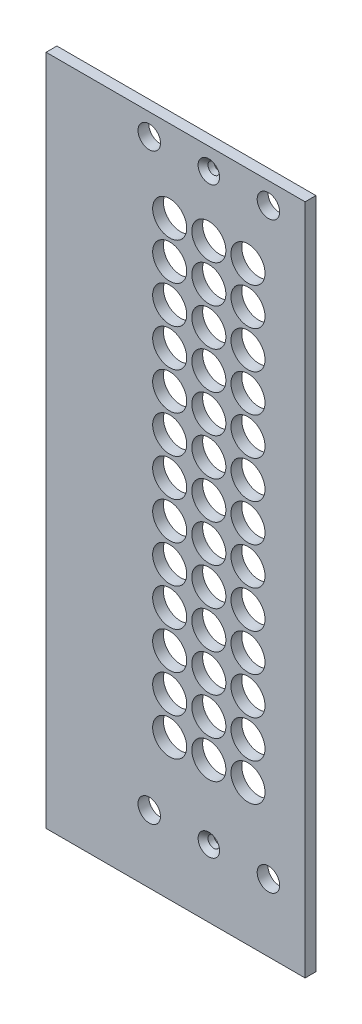
from build123d import *

# Parameters (mm, degrees)
SKETCH1_W                                       = 56.55
SKETCH1_H                                       = 197.425
BOSS_EXTRUDE1_DEPTH                             = 3.175
SKETCH4_R                                       = 5
CUT_EXTRUDE2_DEPTH                              = 103.731270343
LPATTERN3_COUNT                                 = 13
LPATTERN3_PITCH                                 = 11
SKETCH5_W                                       = 3.175
SKETCH5_H                                       = 197.425
BOSS_EXTRUDE2_DEPTH                             = 19.525
CSK_FOR_M3_FLAT_HEAD_MACHINE_SCREW1_D           = 3.4
CSK_FOR_M3_FLAT_HEAD_MACHINE_SCREW1_CSINK_D     = 6.3
CSK_FOR_M3_FLAT_HEAD_MACHINE_SCREW1_CSINK_ANGLE = 90
M6_CLEARANCE_HOLE1_D                            = 6.6


with BuildPart() as part:
    # Sketch1 → Boss-Extrude1 (new body)
    with BuildSketch(Plane.XY):
        Rectangle(SKETCH1_W, SKETCH1_H)
    extrude(amount=BOSS_EXTRUDE1_DEPTH)

    # Sketch4 → Cut-Extrude2 (cut, through all)
    with BuildSketch(Plane.XY.offset(3.175)):
        with Locations((0, -57.369162839)):
            Circle(SKETCH4_R)
        with Locations((11.5, -57.369162839)):
            Circle(SKETCH4_R)
        with Locations((-11.5, -57.369162839)):
            Circle(SKETCH4_R)
    cut_extrude2 = extrude(amount=-CUT_EXTRUDE2_DEPTH, mode=Mode.SUBTRACT)

    # LPattern3: Cut-Extrude2 ×13
    with Locations(*[(0, i * LPATTERN3_PITCH, 0) for i in range(1, LPATTERN3_COUNT)]):
        add(cut_extrude2, mode=Mode.SUBTRACT)

    # Sketch5 → Boss-Extrude2 (add)
    with BuildSketch(Plane.ZY.offset(28.275)):
        with Locations((1.5875, 0)):
            Rectangle(SKETCH5_W, SKETCH5_H)
    extrude(amount=BOSS_EXTRUDE2_DEPTH)

    # CSK for M3 Flat Head Machine Screw1 (through all)
    with Locations(Plane.XY.offset(3.175)):
        with Locations((0, 92.3625), (0, -78.8875)):
            CounterSinkHole(CSK_FOR_M3_FLAT_HEAD_MACHINE_SCREW1_D / 2, CSK_FOR_M3_FLAT_HEAD_MACHINE_SCREW1_CSINK_D / 2, counter_sink_angle=CSK_FOR_M3_FLAT_HEAD_MACHINE_SCREW1_CSINK_ANGLE)

    # M6 Clearance Hole1 (through all)
    with Locations(Plane.XY.offset(3.175)):
        with Locations((-17.5, -78.8875), (17.5, -78.8875), (-17.5, 92.3625), (17.5, 92.3625)):
            Hole(M6_CLEARANCE_HOLE1_D / 2)


solid = part.part
